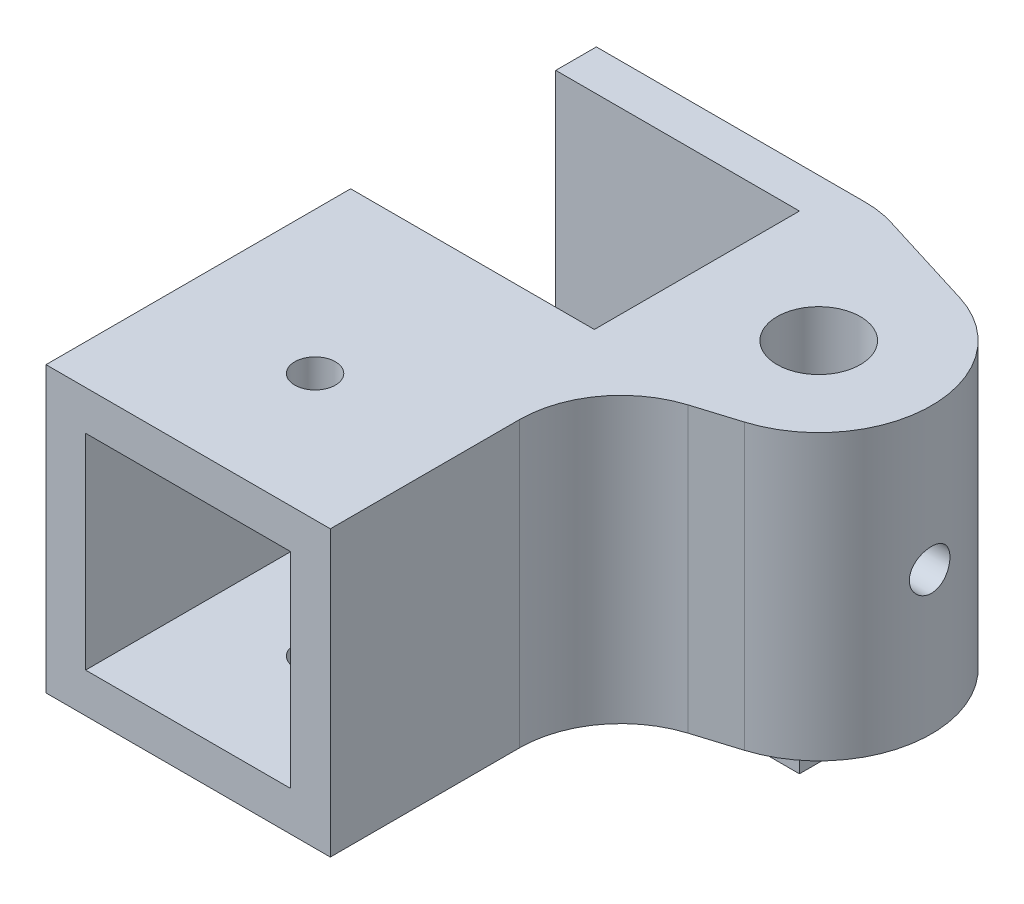
from build123d import *

# Parameters (mm, degrees)
SKETCH1_R           = 4.1
BOSS_EXTRUDE1_DEPTH = 28
SKETCH2_W           = 20.2
SKETCH2_H           = 20.2
CUT_EXTRUDE1_DEPTH  = 25
SKETCH3_R           = 2
CUT_EXTRUDE2_DEPTH  = 78.071719846
FILLET1_R           = 10
SKETCH4_W           = 24
SKETCH4_H           = 4
BOSS_EXTRUDE2_DEPTH = 20
CUT_EXTRUDE3_DEPTH  = 66.556387942
CUT_EXTRUDE4_START  = 15.579105931
CUT_EXTRUDE4_DEPTH  = 7.520894069


# Read off the part's stored shape, not the designer's step: Cut-Extrude4
with BuildPart() as part:
    # Sketch1 → Boss-Extrude1 (new body)
    # profile 1 of 2: a face of its own
    with BuildSketch(Plane(origin=(0, 0, 0), x_dir=(1, 0, 0), z_dir=(0, 1, 0))):
        with BuildLine():
            Line((39.285734559, 50.702544431), (28, 54.2))
            Line((28, 54.2), (28, 26))
            Line((28, 26), (39.285734559, 29.497455569))
            ThreePointArc((39.285734559, 29.497455569), (47.1, 40.1), (39.285734559, 50.702544431))
        make_face()
        with Locations(Location((36, 40.1, 0), (0, 0, 270))):
            Circle(SKETCH1_R, mode=Mode.SUBTRACT)
    # profile 2 of 2: a face of its own
    with BuildSketch(Plane(origin=(0, 0, 0), x_dir=(1, 0, 0), z_dir=(0, 1, 0))):
        Polygon((28, 0), (28, 54.2), (0, 54.2), (0, 50.2), (24, 50.2), (24, 30), (0, 30), (0, 0), align=None)
    extrude(amount=BOSS_EXTRUDE1_DEPTH)

    # Sketch2 → Cut-Extrude1 (cut)
    with BuildSketch(Plane.XY):
        with Locations((14, 14)):
            Rectangle(SKETCH2_W, SKETCH2_H)
    extrude(amount=-CUT_EXTRUDE1_DEPTH, mode=Mode.SUBTRACT)

    # Sketch3 → Cut-Extrude2 (cut, through all)
    with BuildSketch(Plane(origin=(0, 28, 0), x_dir=(1, 0, 0), z_dir=(0, 1, 0))):
        with Locations(Location((14, 12.5, 0), (0, 0, 270))):
            Circle(SKETCH3_R)
    extrude(amount=-CUT_EXTRUDE2_DEPTH, mode=Mode.SUBTRACT)

    # Fillet1
    fillet1_edges = [part.edges().sort_by_distance(p)[0] for p in [
        (28, 14, -26),
        (28, 14, -54.2),
    ]]
    fillet(fillet1_edges, radius=FILLET1_R)

    # Sketch4 → Boss-Extrude2 (add)
    with BuildSketch(Plane.XZ):
        with Locations((12, -52.2)):
            Rectangle(SKETCH4_W, SKETCH4_H)
    extrude(amount=BOSS_EXTRUDE2_DEPTH)

    # Sketch5 → Cut-Extrude3 (cut, through all)
    with BuildSketch(Plane(origin=(24, 0, 0), x_dir=(0, 0, -1), z_dir=(1, 0, 0))):
        Polygon((54.2, -11.327905619), (54.2, -8.672094381), (53.2, -9.24944465), (53.2, -10.75055535), align=None)
        Polygon((53.2, -10.75055535), (53.2, -9.24944465), (51.9, -10), align=None)
    extrude(amount=-CUT_EXTRUDE3_DEPTH, mode=Mode.SUBTRACT)

    # Cut-Extrude4 outline → Cut-Extrude4 (cut)
    with BuildSketch(Plane(origin=(24, 0, 0), x_dir=(0, 0, -1), z_dir=(1, 0, 0)).offset(CUT_EXTRUDE4_START)):
        with BuildLine():
            add(Edge.make_bspline(
                [(38.1, 14), (38.1, 13.470320913), (38.317750981, 12.95373695), (39.054148284, 12.217509573), (39.57591962, 12.000304151), (40.621756395, 11.999696524), (41.14157679, 12.213335487), (41.886144514, 12.957531743), (42.099791904, 13.47657128), (42.100207779, 14.521837258), (41.883895964, 15.043849972), (41.147138028, 15.78196788), (40.629992878, 15.999596004), (39.573060585, 16.00040283), (39.055030391, 15.78291354), (38.318631187, 15.047600747), (38.1, 14.529679087), (38.1, 14)],
                knots=[0, 0, 0, 0, 0.125, 0.125, 0.25, 0.25, 0.375, 0.375, 0.5, 0.5, 0.625, 0.625, 0.75, 0.75, 0.875, 0.875, 1, 1, 1, 1], degree=3))
        make_face()
    extrude(amount=CUT_EXTRUDE4_DEPTH, mode=Mode.SUBTRACT)


solid = part.part
